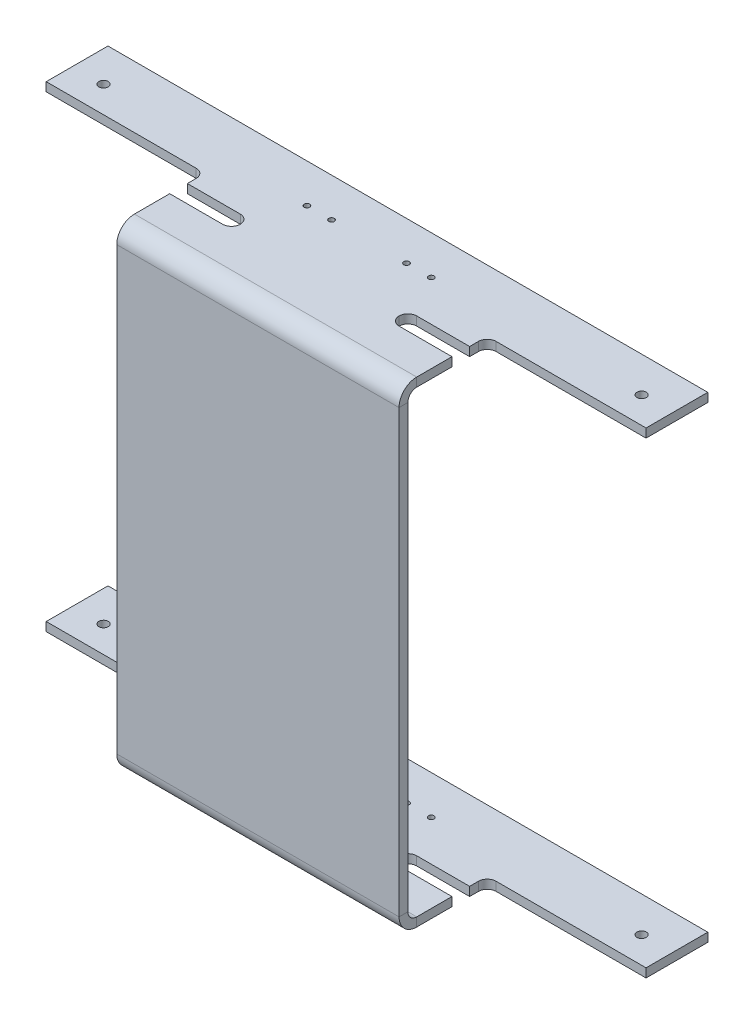
from build123d import *

# Parameters (mm, degrees)
BOSS_EXTRUDE1_DEPTH              = 6.35
SKETCH2_W                        = 203.2
SKETCH2_H                        = 6.35
BOSS_EXTRUDE2_DEPTH              = 330.2
BOSS_EXTRUDE3_DEPTH              = 6.35
F_17_64_0_26563_DIAMETER_HOLE1_D = 6.747002
CONVERT_SOLID1_START             = -101.6
CONVERT_SOLID1_DEPTH             = 203.2
CONVERT_SOLID1_2_DEPTH           = 203.2
F_5_32_0_15625_DIAMETER_HOLE1_D  = 3.96875
FILLET1_R                        = 6.35
FILLET2_R                        = 6.35


# Read off the part's stored shape, not the designer's step: Convert-Solid1
with BuildPart() as part:
    # Sketch1 → Boss-Extrude1 (new body)
    with BuildSketch(Plane(origin=(0, 0, 0), x_dir=(1, 0, 0), z_dir=(0, 1, 0))):
        Polygon((-215.9, 107.95), (-215.9, 63.5), (-101.6, 63.5), (-101.6, 50.8), (-57.15, 50.8), (-57.15, 38.1), (-101.6, 38.1), (-101.6, 0), (101.6, 0), (101.6, 38.1), (57.15, 38.1), (57.15, 50.8), (101.6, 50.8), (101.6, 63.5), (215.9, 63.5), (215.9, 107.95), align=None)
    extrude(amount=BOSS_EXTRUDE1_DEPTH)

    # Sketch2 → Boss-Extrude2 (add)
    with BuildSketch(Plane.XZ):
        with Locations((0, -3.175)):
            Rectangle(SKETCH2_W, SKETCH2_H)
    extrude(amount=BOSS_EXTRUDE2_DEPTH)

    # Sketch3 → Boss-Extrude3 (add)
    with BuildSketch(Plane.XZ.offset(330.2)):
        Polygon((-215.9, -107.95), (215.9, -107.95), (215.9, -63.5), (101.6, -63.5), (101.6, -50.8), (57.15, -50.8), (57.15, -38.1), (101.6, -38.1), (101.6, 0), (-101.6, 0), (-101.6, -38.1), (-57.15, -38.1), (-57.15, -50.8), (-101.6, -50.8), (-101.6, -63.5), (-215.9, -63.5), align=None)
    extrude(amount=BOSS_EXTRUDE3_DEPTH)

    # 17/64 (0.26563) Diameter Hole1 (through all)
    with Locations(Plane(origin=(0, 6.35, 0), x_dir=(1, 0, 0), z_dir=(0, 1, 0))):
        with Locations((-193.675, 82.55), (193.675, 82.55)):
            Hole(F_17_64_0_26563_DIAMETER_HOLE1_D / 2)

    # Convert-Solid1 outline → Convert-Solid1 (cut)
    with BuildSketch(Plane.YZ.offset(CONVERT_SOLID1_START)):
        with BuildLine():
            Line((6.35, 0), (-6.35, 0))
            ThreePointArc((-6.35, 0), (2.630256121, -3.719743879), (6.35, -12.7))
            Line((6.35, -12.7), (6.35, 0))
        make_face()
        with BuildLine():
            ThreePointArc((-336.55, -12.7), (-332.830256121, -3.719743879), (-323.85, 0))
            Line((-323.85, 0), (-336.55, 0))
            Line((-336.55, 0), (-336.55, -12.7))
        make_face()
    extrude(amount=CONVERT_SOLID1_DEPTH, mode=Mode.SUBTRACT)

    # Convert-Solid1 2 outline → Convert-Solid1 2 (add)
    with BuildSketch(Plane.YZ.offset(CONVERT_SOLID1_START)):
        with BuildLine():
            Line((0, -6.35), (-6.35, -6.35))
            ThreePointArc((-6.35, -6.35), (-1.859871939, -8.209871939), (0, -12.7))
            Line((0, -12.7), (0, -6.35))
        make_face()
        with BuildLine():
            ThreePointArc((-330.2, -12.7), (-328.340128061, -8.209871939), (-323.85, -6.35))
            Line((-323.85, -6.35), (-330.2, -6.35))
            Line((-330.2, -6.35), (-330.2, -12.7))
        make_face()
    extrude(amount=CONVERT_SOLID1_2_DEPTH)

    # 5/32 (0.15625) Diameter Hole1 (through all)
    with Locations(Plane(origin=(-44.7675, 6.35, -80.01), x_dir=(0, 0, 1), z_dir=(0, 1, 0))):
        with Locations((0, 0), (0, 17.78), (0, 71.755), (0, 89.535)):
            Hole(F_5_32_0_15625_DIAMETER_HOLE1_D / 2)

    # Fillet1
    fillet1_edges = [part.edges().sort_by_distance(p)[0] for p in [
        (57.15, -333.375, -38.1),
        (57.15, -333.375, -50.8),
        (57.15, 3.175, -38.1),
        (57.15, 3.175, -50.8),
        (-57.15, -333.375, -50.8),
        (-57.15, 3.175, -38.1),
        (-57.15, -333.375, -38.1),
        (-57.15, 3.175, -50.8),
    ]]
    fillet(fillet1_edges, radius=FILLET1_R - 0.0001)  # a hair under: the kernel refuses the full size

    # Fillet2
    fillet2_edges = [part.edges().sort_by_distance(p)[0] for p in [
        (101.6, 3.175, -63.5),
        (-101.6, 3.175, -63.5),
        (-101.6, -333.375, -63.5),
        (101.6, -333.375, -63.5),
    ]]
    fillet(fillet2_edges, radius=FILLET2_R)


solid = part.part
